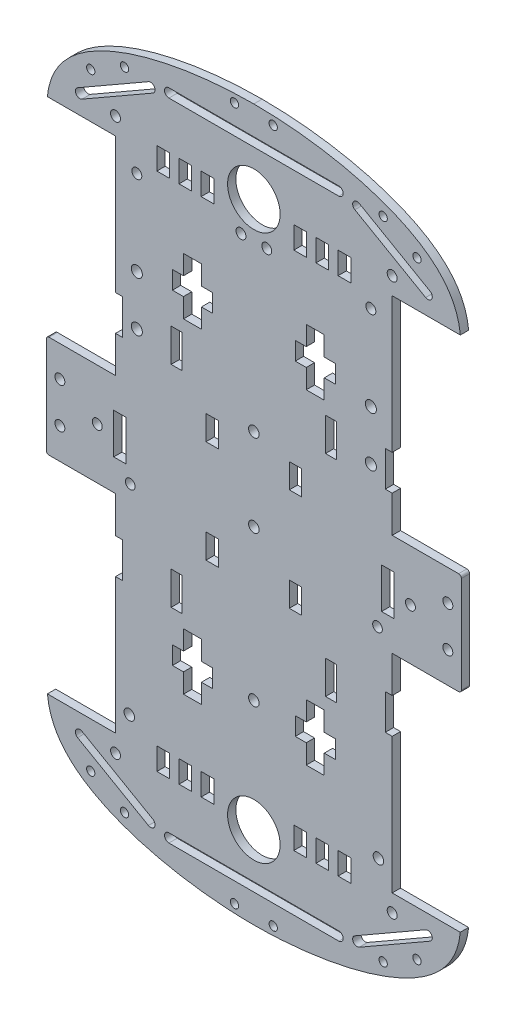
from build123d import *

# Parameters (mm, degrees)
ESBO_O1_R                = 1.5
ESBO_O1_R_2              = 1.8
ESBO_O1_R_3              = 1.9
ESBO_O1_R_4              = 9.5
ESBO_O1_W                = 4.6
ESBO_O1_H                = 8
ESBO_O1_R_5              = 1.75
ESBO_O1_W_2              = 4
ESBO_O1_H_2              = 12
ESBO_O1_W_3              = 4.5
ESBO_O1_H_3              = 8.864124738
ESBO_O1_H_4              = 14.6
ESBO_O1_R_6              = 2
RESSALTO_EXTRUS_O1_DEPTH = 3


with BuildPart() as part:
    # Esboço1 → Ressalto-extrusão1 (new body)
    with BuildSketch(Plane.XY):
        with BuildLine():
            Line((137.154437838, 93.462974016), (137.154437838, 44.446894439))
            Line((137.154437838, 44.446894439), (139.654437838, 44.446894439))
            Line((139.654437838, 44.446894439), (139.654437838, 31.678967302))
            Line((139.654437838, 31.678967302), (137.154437838, 31.678967302))
            Line((137.154437838, 31.678967302), (137.154437838, 18.462974016))
            Line((137.154437838, 18.462974016), (113.154437838, 18.462974016))
            ThreePointArc((113.154437838, 18.462974016), (112.447331057, 18.170080797), (112.154437838, 17.462974016))
            Line((112.154437838, 17.462974016), (112.154437838, -17.462974016))
            ThreePointArc((112.154437838, -17.462974016), (112.447331057, -18.170080797), (113.154437838, -18.462974016))
            Line((113.154437838, -18.462974016), (137.154437838, -18.462974016))
            Line((137.154437838, -18.462974016), (137.154437838, -31.678967302))
            Line((137.154437838, -31.678967302), (139.654437838, -31.678967302))
            Line((139.654437838, -31.678967302), (139.654437838, -44.446894439))
            Line((139.654437838, -44.446894439), (137.154437838, -44.446894439))
            Line((137.154437838, -44.446894439), (137.154437838, -93.462974016))
            Line((137.154437838, -93.462974016), (112.5426188, -93.462974016))
            add(Edge.make_bspline(
                [(112.5426188, -93.462974016), (112.631179268, -94.421865172), (112.890543263, -96.309278909), (113.52631975, -99.049293996), (114.871058812, -102.519110192), (117.393700242, -106.54198266), (120.759651895, -110.238931928), (124.941646356, -113.598126854), (129.86040373, -116.611363451), (135.400193209, -119.273390648), (141.425735677, -121.581494756), (147.796067262, -123.536463608), (154.376798545, -125.143808619), (161.053656206, -126.417523664), (167.735040768, -127.377439626), (174.349719384, -128.044119277), (179.54720509, -128.35732773), (183.378195234, -128.474059436), (185.900904494, -128.5), (187.154437838, -128.5)],
                knots=[0, 0, 0, 0, 0, 0, 0.066666667, 0.133333333, 0.2, 0.266666667, 0.333333333, 0.4, 0.466666667, 0.533333333, 0.6, 0.666666667, 0.733333333, 0.8, 0.866666667, 0.933333333, 1, 1, 1, 1, 1, 1], degree=5))
            add(Edge.make_bspline(
                [(261.766256876, -93.462974016), (261.677696408, -94.421865172), (261.418332412, -96.309278909), (260.782555925, -99.049293996), (259.437816863, -102.519110192), (256.915175434, -106.54198266), (253.549223781, -110.238931928), (249.367229319, -113.598126854), (244.448471946, -116.611363451), (238.908682466, -119.273390648), (232.883139999, -121.581494756), (226.512808414, -123.536463608), (219.932077131, -125.143808619), (213.25521947, -126.417523664), (206.573834908, -127.377439626), (199.959156291, -128.044119277), (194.761670586, -128.35732773), (190.930680442, -128.474059436), (188.407971181, -128.5), (187.154437838, -128.5)],
                knots=[0, 0, 0, 0, 0, 0, 0.066666667, 0.133333333, 0.2, 0.266666667, 0.333333333, 0.4, 0.466666667, 0.533333333, 0.6, 0.666666667, 0.733333333, 0.8, 0.866666667, 0.933333333, 1, 1, 1, 1, 1, 1], degree=5))
            Line((261.766256876, -93.462974016), (237.154437838, -93.462974016))
            Line((237.154437838, -93.462974016), (237.154437838, -44.446894439))
            Line((237.154437838, -44.446894439), (234.654437838, -44.446894439))
            Line((234.654437838, -44.446894439), (234.654437838, -31.678967302))
            Line((234.654437838, -31.678967302), (237.154437838, -31.678967302))
            Line((237.154437838, -31.678967302), (237.154437838, -18.462974016))
            Line((237.154437838, -18.462974016), (261.154437838, -18.462974016))
            ThreePointArc((261.154437838, -18.462974016), (261.861544619, -18.170080797), (262.154437838, -17.462974016))
            Line((262.154437838, -17.462974016), (262.154437838, 17.462974016))
            ThreePointArc((262.154437838, 17.462974016), (261.861544619, 18.170080797), (261.154437838, 18.462974016))
            Line((261.154437838, 18.462974016), (237.154437838, 18.462974016))
            Line((237.154437838, 18.462974016), (237.154437838, 31.678967302))
            Line((237.154437838, 31.678967302), (234.654437838, 31.678967302))
            Line((234.654437838, 31.678967302), (234.654437838, 44.446894439))
            Line((234.654437838, 44.446894439), (237.154437838, 44.446894439))
            Line((237.154437838, 44.446894439), (237.154437838, 93.462974016))
            Line((237.154437838, 93.462974016), (261.766256876, 93.462974016))
            add(Edge.make_bspline(
                [(187.154437838, 128.5), (188.407971181, 128.5), (190.930680442, 128.474059436), (194.761670586, 128.35732773), (199.959156291, 128.044119277), (206.573834908, 127.377439626), (213.25521947, 126.417523664), (219.932077131, 125.143808619), (226.512808414, 123.536463608), (232.883139999, 121.581494756), (238.908682466, 119.273390648), (244.448471946, 116.611363451), (249.367229319, 113.598126854), (253.549223781, 110.238931928), (256.915175434, 106.54198266), (259.437816863, 102.519110192), (260.782555925, 99.049293996), (261.418332412, 96.309278909), (261.677696408, 94.421865172), (261.766256876, 93.462974016)],
                knots=[0, 0, 0, 0, 0, 0, 0.066666667, 0.133333333, 0.2, 0.266666667, 0.333333333, 0.4, 0.466666667, 0.533333333, 0.6, 0.666666667, 0.733333333, 0.8, 0.866666667, 0.933333333, 1, 1, 1, 1, 1, 1], degree=5))
            add(Edge.make_bspline(
                [(187.154437838, 128.5), (185.900904494, 128.5), (183.378195234, 128.474059436), (179.54720509, 128.35732773), (174.349719384, 128.044119277), (167.735040768, 127.377439626), (161.053656206, 126.417523664), (154.376798545, 125.143808619), (147.796067262, 123.536463608), (141.425735677, 121.581494756), (135.400193209, 119.273390648), (129.86040373, 116.611363451), (124.941646356, 113.598126854), (120.759651895, 110.238931928), (117.393700242, 106.54198266), (114.871058812, 102.519110192), (113.52631975, 99.049293996), (112.890543263, 96.309278909), (112.631179268, 94.421865172), (112.5426188, 93.462974016)],
                knots=[0, 0, 0, 0, 0, 0, 0.066666667, 0.133333333, 0.2, 0.266666667, 0.333333333, 0.4, 0.466666667, 0.533333333, 0.6, 0.666666667, 0.733333333, 0.8, 0.866666667, 0.933333333, 1, 1, 1, 1, 1, 1], degree=5))
            Line((112.5426188, 93.462974016), (137.154437838, 93.462974016))
        make_face()
        with Locations((128.198241527, -109.819967605)):
            Circle(ESBO_O1_R, mode=Mode.SUBTRACT)
        with Locations((140.410639508, -116.665209424)):
            Circle(ESBO_O1_R, mode=Mode.SUBTRACT)
        with BuildLine():
            ThreePointArc((123.465058478, -101.721515577), (122.873875538, -99.537367521), (125.058023594, -98.946184581))
            Line((125.058023594, -98.946184581), (150.644661395, -113.632224378))
            ThreePointArc((150.644661395, -113.632224378), (151.235844335, -115.816372434), (149.051696278, -116.407555374))
            Line((149.051696278, -116.407555374), (123.465058478, -101.721515577))
        make_face(mode=Mode.SUBTRACT)
        with Locations((137.160057211, -99.725491141)):
            Circle(ESBO_O1_R_2, mode=Mode.SUBTRACT)
        with Locations((142.127489329, -85.144618245)):
            Circle(ESBO_O1_R_3, mode=Mode.SUBTRACT)
        with Locations((180.154437838, -125.317141839)):
            Circle(ESBO_O1_R, mode=Mode.SUBTRACT)
        with Locations((187.154437838, -98.687197748)):
            Circle(ESBO_O1_R_4, mode=Mode.SUBTRACT)
        with Locations((154.403856298, -93.96045009)):
            Rectangle(ESBO_O1_W, ESBO_O1_H, mode=Mode.SUBTRACT)
        with Locations((162.403856298, -93.96045009)):
            Rectangle(ESBO_O1_W, ESBO_O1_H, mode=Mode.SUBTRACT)
        with Locations((170.403856298, -93.96045009)):
            Rectangle(ESBO_O1_W, ESBO_O1_H, mode=Mode.SUBTRACT)
        with Locations((117.047813034, -7.3)):
            Circle(ESBO_O1_R_2, mode=Mode.SUBTRACT)
        with Locations((142.474241724, -12.788348158)):
            Circle(ESBO_O1_R_5, mode=Mode.SUBTRACT)
        Polygon((157.725516184, -61.983420667), (157.725516184, -55.483420667), (161.712788445, -55.483420667), (161.712788445, -48.483420667), (168.212788445, -48.483420667), (168.212788445, -55.483420667), (172.179722775, -55.483420667), (172.179722775, -61.983420667), (168.212788445, -61.983420667), (168.212788445, -68.983420667), (161.712788445, -68.983420667), (161.712788445, -61.983420667), align=None, mode=Mode.SUBTRACT)
        with Locations((159.257945005, -38.025125224)):
            Rectangle(ESBO_O1_W_2, ESBO_O1_H_2, mode=Mode.SUBTRACT)
        with Locations((187.154437838, -58.184487035)):
            Circle(ESBO_O1_R_3, mode=Mode.SUBTRACT)
        with Locations((172.094043876, -18.534756411)):
            Rectangle(ESBO_O1_W_3, ESBO_O1_H_3, mode=Mode.SUBTRACT)
        with Locations((187.154437838, -3.869303663)):
            Circle(ESBO_O1_R_3, mode=Mode.SUBTRACT)
        with Locations((194.154437838, -125.317141839)):
            Circle(ESBO_O1_R, mode=Mode.SUBTRACT)
        with BuildLine():
            ThreePointArc((156.455455042, -118.190228394), (154.855455042, -116.590228394), (156.455455042, -114.990228394))
            Line((156.455455042, -114.990228394), (217.853420634, -114.990228394))
            ThreePointArc((217.853420634, -114.990228394), (219.453420634, -116.590228394), (217.853420634, -118.190228394))
            Line((217.853420634, -118.190228394), (156.455455042, -118.190228394))
        make_face(mode=Mode.SUBTRACT)
        with Locations((203.905019377, -93.96045009)):
            Rectangle(ESBO_O1_W, ESBO_O1_H, mode=Mode.SUBTRACT)
        with Locations((211.905019377, -93.96045009)):
            Rectangle(ESBO_O1_W, ESBO_O1_H, mode=Mode.SUBTRACT)
        with Locations((219.905019377, -93.96045009)):
            Rectangle(ESBO_O1_W, ESBO_O1_H, mode=Mode.SUBTRACT)
        with Locations((233.898236168, -116.665209424)):
            Circle(ESBO_O1_R, mode=Mode.SUBTRACT)
        with BuildLine():
            Line((223.664214281, -113.632224378), (249.250852082, -98.946184581))
            ThreePointArc((249.250852082, -98.946184581), (251.435000138, -99.537367521), (250.843817198, -101.721515577))
            Line((250.843817198, -101.721515577), (225.257179397, -116.407555374))
            ThreePointArc((225.257179397, -116.407555374), (223.073031341, -115.816372434), (223.664214281, -113.632224378))
        make_face(mode=Mode.SUBTRACT)
        with Locations((237.148818465, -99.725491141)):
            Circle(ESBO_O1_R_2, mode=Mode.SUBTRACT)
        with Locations((246.110634148, -109.819967605)):
            Circle(ESBO_O1_R, mode=Mode.SUBTRACT)
        with Locations((232.181386347, -85.144618245)):
            Circle(ESBO_O1_R_3, mode=Mode.SUBTRACT)
        Polygon((212.596087231, -68.983420667), (206.096087231, -68.983420667), (206.096087231, -61.983420667), (202.129152901, -61.983420667), (202.129152901, -55.483420667), (206.096087231, -55.483420667), (206.096087231, -48.483420667), (212.596087231, -48.483420667), (212.596087231, -55.483420667), (216.583359492, -55.483420667), (216.583359492, -61.983420667), (212.596087231, -61.983420667), align=None, mode=Mode.SUBTRACT)
        with Locations((215.050930671, -38.025125224)):
            Rectangle(ESBO_O1_W_2, ESBO_O1_H_2, mode=Mode.SUBTRACT)
        with Locations((202.214831799, -18.534756411)):
            Rectangle(ESBO_O1_W_3, ESBO_O1_H_3, mode=Mode.SUBTRACT)
        with Locations((231.834633951, -12.788348158)):
            Circle(ESBO_O1_R_5, mode=Mode.SUBTRACT)
        with Locations((257.261062641, -7.3)):
            Circle(ESBO_O1_R_2, mode=Mode.SUBTRACT)
        with Locations((117.047813034, 7.3)):
            Circle(ESBO_O1_R_2, mode=Mode.SUBTRACT)
        with Locations((130.561015586, 0)):
            Circle(ESBO_O1_R_2, mode=Mode.SUBTRACT)
        with Locations((138.762875406, 0)):
            Rectangle(ESBO_O1_W_3, ESBO_O1_H_4, mode=Mode.SUBTRACT)
        with Locations((144.857544245, 36.917956561)):
            Circle(ESBO_O1_R_6, mode=Mode.SUBTRACT)
        with Locations((144.85952347, 54.917956561)):
            Circle(ESBO_O1_R_6, mode=Mode.SUBTRACT)
        with Locations((172.094043876, 18.534756411)):
            Rectangle(ESBO_O1_W_3, ESBO_O1_H_3, mode=Mode.SUBTRACT)
        with Locations((187.154437838, 25.949221825)):
            Circle(ESBO_O1_R_3, mode=Mode.SUBTRACT)
        with Locations((159.257945005, 38.025125224)):
            Rectangle(ESBO_O1_W_2, ESBO_O1_H_2, mode=Mode.SUBTRACT)
        Polygon((161.712788445, 68.983420667), (168.212788445, 68.983420667), (168.212788445, 61.983420667), (172.179722775, 61.983420667), (172.179722775, 55.483420667), (168.212788445, 55.483420667), (168.212788445, 48.483420667), (161.712788445, 48.483420667), (161.712788445, 55.483420667), (157.725516184, 55.483420667), (157.725516184, 61.983420667), (161.712788445, 61.983420667), align=None, mode=Mode.SUBTRACT)
        with Locations((144.862898344, 85.610657286)):
            Circle(ESBO_O1_R_2, mode=Mode.SUBTRACT)
        with Locations((128.198241527, 109.819967605)):
            Circle(ESBO_O1_R, mode=Mode.SUBTRACT)
        with Locations((137.160057211, 99.725491141)):
            Circle(ESBO_O1_R_2, mode=Mode.SUBTRACT)
        with BuildLine():
            Line((150.644661395, 113.632224378), (125.058023594, 98.946184581))
            ThreePointArc((125.058023594, 98.946184581), (122.873875538, 99.537367521), (123.465058478, 101.721515577))
            Line((123.465058478, 101.721515577), (149.051696278, 116.407555374))
            ThreePointArc((149.051696278, 116.407555374), (151.235844335, 115.816372434), (150.644661395, 113.632224378))
        make_face(mode=Mode.SUBTRACT)
        with Locations((140.410639508, 116.665209424)):
            Circle(ESBO_O1_R, mode=Mode.SUBTRACT)
        with Locations((154.403856298, 93.96045009)):
            Rectangle(ESBO_O1_W, ESBO_O1_H, mode=Mode.SUBTRACT)
        with Locations((162.403856298, 93.96045009)):
            Rectangle(ESBO_O1_W, ESBO_O1_H, mode=Mode.SUBTRACT)
        with Locations((170.403856298, 93.96045009)):
            Rectangle(ESBO_O1_W, ESBO_O1_H, mode=Mode.SUBTRACT)
        with Locations((182.488372828, 85.606520105)):
            Circle(ESBO_O1_R_2, mode=Mode.SUBTRACT)
        with Locations((187.154437838, 98.687197748)):
            Circle(ESBO_O1_R_4, mode=Mode.SUBTRACT)
        with Locations((180.154437838, 125.317141839)):
            Circle(ESBO_O1_R, mode=Mode.SUBTRACT)
        with Locations((202.214831799, 18.534756411)):
            Rectangle(ESBO_O1_W_3, ESBO_O1_H_3, mode=Mode.SUBTRACT)
        with Locations((215.050930671, 38.025125224)):
            Rectangle(ESBO_O1_W_2, ESBO_O1_H_2, mode=Mode.SUBTRACT)
        Polygon((216.583359492, 61.983420667), (216.583359492, 55.483420667), (212.596087231, 55.483420667), (212.596087231, 48.483420667), (206.096087231, 48.483420667), (206.096087231, 55.483420667), (202.129152901, 55.483420667), (202.129152901, 61.983420667), (206.096087231, 61.983420667), (206.096087231, 68.983420667), (212.596087231, 68.983420667), (212.596087231, 61.983420667), align=None, mode=Mode.SUBTRACT)
        with Locations((235.54600027, 0)):
            Rectangle(ESBO_O1_W_3, ESBO_O1_H_4, mode=Mode.SUBTRACT)
        with Locations((243.747860089, 0)):
            Circle(ESBO_O1_R_2, mode=Mode.SUBTRACT)
        with Locations((257.261062641, 7.3)):
            Circle(ESBO_O1_R_2, mode=Mode.SUBTRACT)
        with Locations((229.45133143, 36.917956561)):
            Circle(ESBO_O1_R_6, mode=Mode.SUBTRACT)
        with Locations((229.449352206, 54.917956561)):
            Circle(ESBO_O1_R_6, mode=Mode.SUBTRACT)
        with Locations((191.820502848, 85.606520105)):
            Circle(ESBO_O1_R_2, mode=Mode.SUBTRACT)
        with Locations((203.905019377, 93.96045009)):
            Rectangle(ESBO_O1_W, ESBO_O1_H, mode=Mode.SUBTRACT)
        with Locations((211.905019377, 93.96045009)):
            Rectangle(ESBO_O1_W, ESBO_O1_H, mode=Mode.SUBTRACT)
        with Locations((219.905019377, 93.96045009)):
            Rectangle(ESBO_O1_W, ESBO_O1_H, mode=Mode.SUBTRACT)
        with BuildLine():
            Line((156.455455042, 118.190228394), (217.853420634, 118.190228394))
            ThreePointArc((217.853420634, 118.190228394), (219.453420634, 116.590228394), (217.853420634, 114.990228394))
            Line((217.853420634, 114.990228394), (156.455455042, 114.990228394))
            ThreePointArc((156.455455042, 114.990228394), (154.855455042, 116.590228394), (156.455455042, 118.190228394))
        make_face(mode=Mode.SUBTRACT)
        with Locations((194.154437838, 125.317141839)):
            Circle(ESBO_O1_R, mode=Mode.SUBTRACT)
        with Locations((229.445977331, 85.610657286)):
            Circle(ESBO_O1_R_2, mode=Mode.SUBTRACT)
        with Locations((237.148818465, 99.725491141)):
            Circle(ESBO_O1_R_2, mode=Mode.SUBTRACT)
        with BuildLine():
            ThreePointArc((223.664214281, 113.632224378), (223.073031341, 115.816372434), (225.257179397, 116.407555374))
            Line((225.257179397, 116.407555374), (250.843817198, 101.721515577))
            ThreePointArc((250.843817198, 101.721515577), (251.435000138, 99.537367521), (249.250852082, 98.946184581))
            Line((249.250852082, 98.946184581), (223.664214281, 113.632224378))
        make_face(mode=Mode.SUBTRACT)
        with Locations((233.898236168, 116.665209424)):
            Circle(ESBO_O1_R, mode=Mode.SUBTRACT)
        with Locations((246.110634148, 109.819967605)):
            Circle(ESBO_O1_R, mode=Mode.SUBTRACT)
    extrude(amount=RESSALTO_EXTRUS_O1_DEPTH)


solid = part.part
